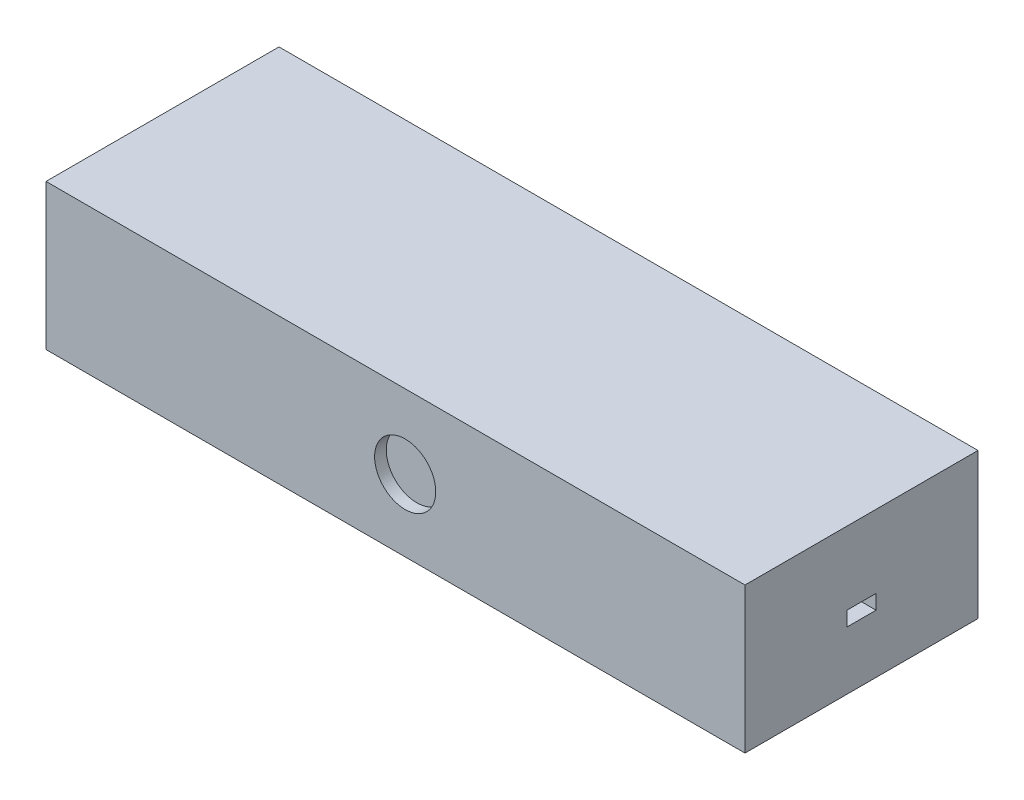
from build123d import *

# Parameters (mm, degrees)
SKETCH1_W           = 240
SKETCH1_H           = 80
BOSS_EXTRUDE1_DEPTH = 50
SKETCH2_W           = 45
SKETCH2_H           = 21
CUT_EXTRUDE1_DEPTH  = 28
SKETCH3_R           = 10.5
CUT_EXTRUDE2_DEPTH  = 4
CUT_EXTRUDE3_START  = 240
SKETCH4_W           = 10
SKETCH4_H           = 5
CUT_EXTRUDE3_DEPTH  = 40


with BuildPart() as part:
    # Sketch1 → Boss-Extrude1 (new body)
    with BuildSketch(Plane(origin=(0, 0, 0), x_dir=(1, 0, 0), z_dir=(0, 1, 0))):
        with Locations((120, 40)):
            Rectangle(SKETCH1_W, SKETCH1_H)
    extrude(amount=BOSS_EXTRUDE1_DEPTH)

    # Sketch2 → Cut-Extrude1 (cut)
    with BuildSketch(Plane(origin=(0, 0, 0), x_dir=(1, 0, 0), z_dir=(0, 1, 0))):
        with Locations((180, 40)):
            Rectangle(SKETCH2_W, SKETCH2_H)
    extrude(amount=CUT_EXTRUDE1_DEPTH, mode=Mode.SUBTRACT)

    # Sketch3 → Cut-Extrude2 (cut)
    with BuildSketch(Plane.XY):
        with Locations((123.320268524, 24.58409494)):
            Circle(SKETCH3_R)
    extrude(amount=-CUT_EXTRUDE2_DEPTH, mode=Mode.SUBTRACT)

    # Sketch4 → Cut-Extrude3 (cut)
    with BuildSketch(Plane(origin=(0, 0, 0), x_dir=(0, 0, -1), z_dir=(1, 0, 0)).offset(CUT_EXTRUDE3_START)):
        with Locations((40, 22.5)):
            Rectangle(SKETCH4_W, SKETCH4_H)
    extrude(amount=-CUT_EXTRUDE3_DEPTH, mode=Mode.SUBTRACT)


solid = part.part
